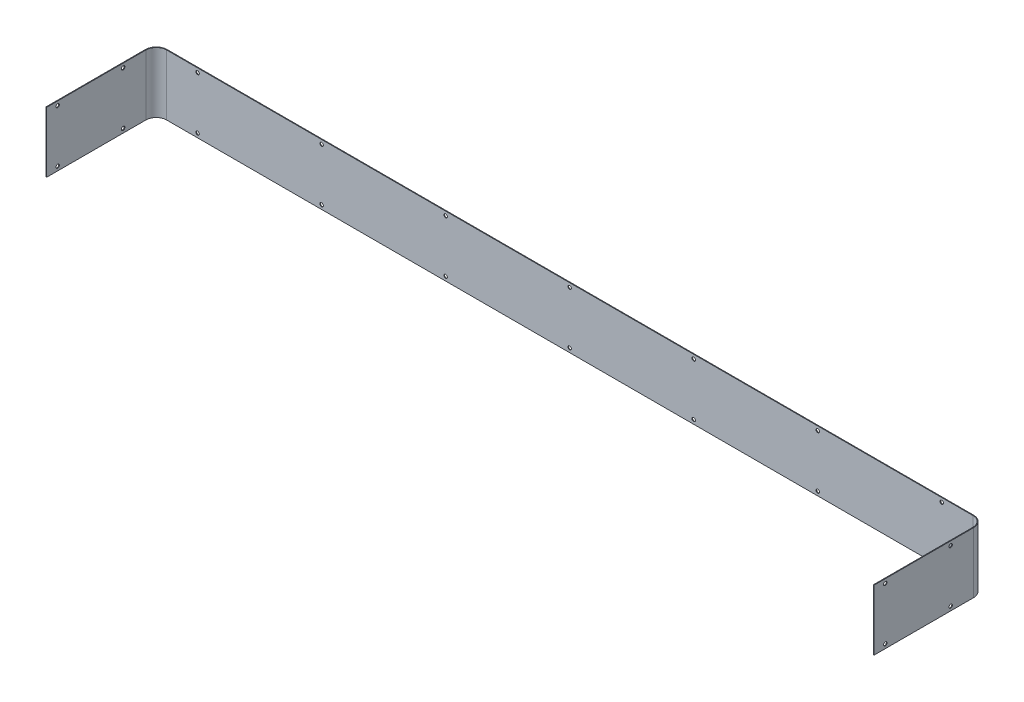
from build123d import *

# Parameters (mm, degrees)
BASE_FLANGE1_DEPTH = 88
SKETCH2_R          = 2.5
CUT_EXTRUDE1_DEPTH = 1216.791100477
SKETCH3_R          = 2.5
CUT_EXTRUDE2_DEPTH = 10


# Read off the part's stored shape, not the designer's step: Base-Flange1
with BuildPart() as part:
    # Base-Flange1 outline → Base-Flange1 (new body)
    with BuildSketch(Plane(origin=(0, 0, 0), x_dir=(1, 0, 0), z_dir=(0, 1, 0))):
        with BuildLine():
            Line((1201, 144), (1201, 0))
            Line((1201, 0), (1202, 0))
            Line((1202, 0), (1202, 144))
            ThreePointArc((1202, 144), (1197.313708499, 155.313708499), (1186, 160))
            Line((1186, 160), (16, 160))
            ThreePointArc((16, 160), (4.686291501, 155.313708499), (0, 144))
            Line((0, 144), (0, 0))
            Line((0, 0), (1, 0))
            Line((1, 0), (1, 144))
            ThreePointArc((1, 144), (5.393398282, 154.606601718), (16, 159))
            Line((16, 159), (1186, 159))
            ThreePointArc((1186, 159), (1196.606601718, 154.606601718), (1201, 144))
        make_face()
    extrude(amount=BASE_FLANGE1_DEPTH)

    # Sketch2 → Cut-Extrude1 (cut, through all)
    with BuildSketch(Plane(origin=(1202, 0, 0), x_dir=(0, 0, -1), z_dir=(1, 0, 0))):
        with Locations((16, 82)):
            Circle(SKETCH2_R)
        with Locations((111, 82)):
            Circle(SKETCH2_R)
        with Locations(Location((111, 6, 0), (0, 0, 180))):
            Circle(SKETCH2_R)
        with Locations(Location((16, 6, 0), (0, 0, 180))):
            Circle(SKETCH2_R)
    extrude(amount=-CUT_EXTRUDE1_DEPTH, mode=Mode.SUBTRACT)

    # Sketch3 → Cut-Extrude2 (cut)
    with BuildSketch(Plane(origin=(0, 0, -160), x_dir=(-1, 0, 0), z_dir=(0, 0, -1))):
        with Locations((-1141, 82)):
            Circle(SKETCH3_R)
        with Locations((-961, 82)):
            Circle(SKETCH3_R)
        with Locations((-781, 82)):
            Circle(SKETCH3_R)
        with Locations((-601, 82)):
            Circle(SKETCH3_R)
        with Locations((-421, 82)):
            Circle(SKETCH3_R)
        with Locations((-241, 82)):
            Circle(SKETCH3_R)
        with Locations((-61, 82)):
            Circle(SKETCH3_R)
        with Locations((-961, 6)):
            Circle(SKETCH3_R)
        with Locations((-781, 6)):
            Circle(SKETCH3_R)
        with Locations((-601, 6)):
            Circle(SKETCH3_R)
        with Locations((-421, 6)):
            Circle(SKETCH3_R)
        with Locations((-241, 6)):
            Circle(SKETCH3_R)
        with Locations((-61, 6)):
            Circle(SKETCH3_R)
        with Locations((-1141, 6)):
            Circle(SKETCH3_R)
    extrude(amount=-CUT_EXTRUDE2_DEPTH, mode=Mode.SUBTRACT)


solid = part.part
